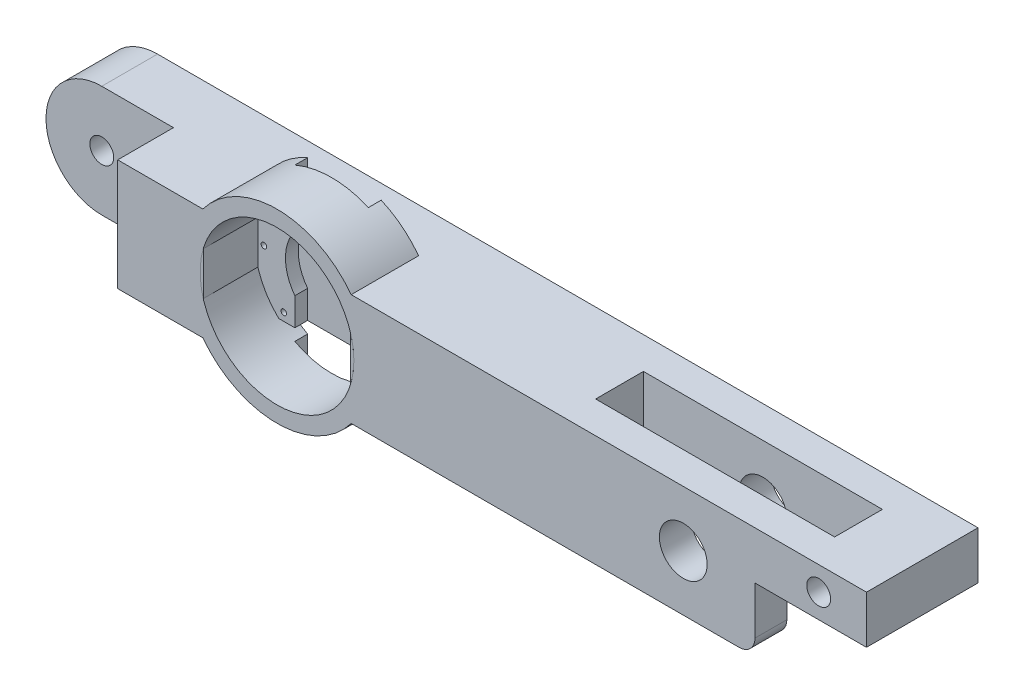
from build123d import *

# Parameters (mm, degrees)
SKETCH_2_W           = 400
SKETCH_2_H           = 70
SKETCH_2_W_2         = 70
SKETCH_2_H_2         = 30
EXTRUDE_2_DEPTH      = 70
SKETCH_3_R           = 7.5
SKETCH_3_R_2         = 15
CUT_EXTRUDE_1_DEPTH  = 282.113855937
SKETCH_4_W           = 120
SKETCH_4_H           = 30
SKETCH_4_W_2         = 30
CUT_EXTRUDE_2_DEPTH  = 120
FILLET_1_R           = 10
SKETCH_5_R           = 48.25
CUT_EXTRUDE_3_DEPTH  = 34.3
EXTRUDE_3_DEPTH      = 42.3
EXTRUDE_4_DEPTH      = 42.3
EXTRUDE_4_2_DEPTH    = 42.3
SKETCH_8_R           = 1.75
CUT_EXTRUDE_4_DEPTH  = 42.3
SKETCH_11_R          = 29
CUT_EXTRUDE_6_DEPTH  = 8
CUT_EXTRUDE_7_DEPTH  = 8
SKETCH_13_W          = 35
SKETCH_13_H          = 70
EXTRUDE_5_DEPTH      = 80
FILLET_2_R           = 35
SKETCH_14_R          = 7.5
CUT_EXTRUDE_8_DEPTH  = 295.436856558
SKETCH_15_W          = 46.18239298
SKETCH_15_H          = 8
CUT_EXTRUDE_10_DEPTH = 500


with BuildPart() as part:
    # 草图2 → 凸台-拉伸2 (new body)
    with BuildSketch(Plane.XY):
        Rectangle(SKETCH_2_W, SKETCH_2_H)
        with Locations((235, 20)):
            Rectangle(SKETCH_2_W_2, SKETCH_2_H_2)
    extrude(amount=EXTRUDE_2_DEPTH)

    # 草图3 → 切除-拉伸1 (cut, through all)
    with BuildSketch(Plane.XY.offset(70)):
        with Locations((240, 20)):
            Circle(SKETCH_3_R)
        with Locations((155, 0)):
            Circle(SKETCH_3_R_2)
    extrude(amount=-CUT_EXTRUDE_1_DEPTH, mode=Mode.SUBTRACT)

    # 草图4 → 切除-拉伸2 (cut)
    with BuildSketch(Plane.XZ.offset(35)):
        with Locations((140, 35)):
            Rectangle(SKETCH_4_W, SKETCH_4_H)
        with Locations((215, 35)):
            Rectangle(SKETCH_4_W_2, SKETCH_4_H)
    extrude(amount=-CUT_EXTRUDE_2_DEPTH, mode=Mode.SUBTRACT)

    # 圆角1
    fillet_1_edges = [part.edges().sort_by_distance(p)[0] for p in [
        (200, -35, 60),
        (200, -35, 10),
    ]]
    fillet(fillet_1_edges, radius=FILLET_1_R)

    # 草图5 → 切除-拉伸3 (cut)
    with BuildSketch(Plane.XY.offset(70)):
        with Locations((-100, 0)):
            Circle(SKETCH_5_R)
    extrude(amount=-CUT_EXTRUDE_3_DEPTH, mode=Mode.SUBTRACT)

    # 草图6 → 凸台-拉伸3 (add)
    with BuildSketch(Plane.XY.offset(70)):
        with BuildLine():
            ThreePointArc((-51.75, 0), (-55.668520983, -19.046849298), (-66.787615262, -35))
            Line((-66.787615262, -35), (-53.437541946, -35))
            ThreePointArc((-53.437541946, -35), (-44.749091946, -18.449923013), (-41.75, 0))
            ThreePointArc((-41.75, 0), (-44.749091946, 18.449923013), (-53.437541946, 35))
            Line((-53.437541946, 35), (-66.787615262, 35))
            ThreePointArc((-66.787615262, 35), (-55.668520983, 19.046849298), (-51.75, 0))
        make_face()
        with BuildLine():
            Line((-53.437541946, -35), (-66.787615262, -35))
            ThreePointArc((-66.787615262, -35), (-148.25, 0), (-66.787615262, 35))
            Line((-66.787615262, 35), (-53.437541946, 35))
            ThreePointArc((-53.437541946, 35), (-158.25, 0), (-53.437541946, -35))
        make_face()
        with BuildLine():
            ThreePointArc((-51.75, 0), (-55.668520983, -19.046849298), (-66.787615262, -35))
            Line((-66.787615262, -35), (-53.437541946, -35))
            ThreePointArc((-53.437541946, -35), (-44.749091946, -18.449923013), (-41.75, 0))
            ThreePointArc((-41.75, 0), (-44.749091946, 18.449923013), (-53.437541946, 35))
            Line((-53.437541946, 35), (-66.787615262, 35))
            ThreePointArc((-66.787615262, 35), (-55.668520983, 19.046849298), (-51.75, 0))
        make_face()
    extrude(amount=-EXTRUDE_3_DEPTH)

    # 草图8 → 切除-拉伸4 (cut)
    with BuildSketch(Plane.XY.offset(35.7)):
        with Locations((-142.5, 0)):
            Circle(SKETCH_8_R)
        with Locations((-130.0520382, 30.0520382)):
            Circle(SKETCH_8_R)
        with Locations((-100, 42.5)):
            Circle(SKETCH_8_R)
        with Locations((-69.9479618, 30.0520382)):
            Circle(SKETCH_8_R)
        with Locations((-57.5, 0)):
            Circle(SKETCH_8_R)
        with Locations((-69.9479618, -30.0520382)):
            Circle(SKETCH_8_R)
        with Locations((-100, -42.5)):
            Circle(SKETCH_8_R)
        with Locations((-130.0520382, -30.0520382)):
            Circle(SKETCH_8_R)
    extrude(amount=-CUT_EXTRUDE_4_DEPTH, mode=Mode.SUBTRACT)

    # 草图11 → 切除-拉伸6 (cut)
    with BuildSketch(Plane.XY.offset(35.7)):
        with Locations((-100, 0)):
            Circle(SKETCH_11_R)
    extrude(amount=-CUT_EXTRUDE_6_DEPTH, mode=Mode.SUBTRACT)

    # 草图12 → 切除-拉伸7 (cut)
    with BuildSketch(Plane.XY.offset(35.7)):
        with BuildLine():
            Line((-100, 29), (-100, 35))
            Line((-100, 35), (-123.09119649, 35))
            Line((-123.09119649, 35), (-123.09119649, 17.544134195))
            ThreePointArc((-123.09119649, 17.544134195), (-112.888368949, 25.978644034), (-100, 29))
        make_face()
        with BuildLine():
            Line((-76.90880351, 17.544134195), (-76.90880351, 35))
            Line((-76.90880351, 35), (-100, 35))
            Line((-100, 35), (-100, 29))
            ThreePointArc((-100, 29), (-87.111631051, 25.978644034), (-76.90880351, 17.544134195))
        make_face()
        with BuildLine():
            ThreePointArc((-100, -29), (-107.281043458, -28.071095564), (-114.09564598, -25.34389008))
            Line((-114.09564598, -25.34389008), (-114.09564598, -35))
            Line((-114.09564598, -35), (-100, -35))
            Line((-100, -35), (-100, -29))
        make_face()
        with BuildLine():
            Line((-85.90435402, -35), (-85.90435402, -25.34389008))
            ThreePointArc((-85.90435402, -25.34389008), (-92.718956542, -28.071095564), (-100, -29))
            Line((-100, -29), (-100, -35))
            Line((-100, -35), (-85.90435402, -35))
        make_face()
    extrude(amount=-CUT_EXTRUDE_7_DEPTH, mode=Mode.SUBTRACT)

    # 草图13 → 凸台-拉伸5 (add)
    with BuildSketch(Plane.ZY.offset(200)):
        with Locations((17.5, 0)):
            Rectangle(SKETCH_13_W, SKETCH_13_H)
    extrude(amount=EXTRUDE_5_DEPTH)

    # 圆角2
    fillet_2_edges = [part.edges().sort_by_distance(p)[0] for p in [
        (-280, 35, 17.5),
        (-280, -35, 17.5),
    ]]
    fillet(fillet_2_edges, radius=FILLET_2_R - 0.0001)  # a hair under: the kernel refuses the full size

    # 草图14 → 切除-拉伸8 (cut, through all)
    with BuildSketch(Plane.XY.offset(70)):
        with Locations((-245, 0)):
            Circle(SKETCH_14_R)
    extrude(amount=-CUT_EXTRUDE_8_DEPTH, mode=Mode.SUBTRACT)

    # 草图15 → 切除-拉伸10 (cut, symmetric)
    with BuildSketch(Plane(origin=(0, 35, 0), x_dir=(1, 0, 0), z_dir=(0, 1, 0))):
        with Locations((-100, -31.7)):
            Rectangle(SKETCH_15_W, SKETCH_15_H)
    extrude(amount=CUT_EXTRUDE_10_DEPTH, both=True, mode=Mode.SUBTRACT)


with BuildPart() as body_2:
    # 草图7 → 凸台-拉伸4 (new body)
    with BuildSketch(Plane.XY.offset(70)):
        with BuildLine():
            Line((-146.25, -13.747727085), (-146.25, 13.747727085))
            ThreePointArc((-146.25, 13.747727085), (-148.25, 0), (-146.25, -13.747727085))
        make_face()
    extrude(amount=-EXTRUDE_4_DEPTH)


with BuildPart() as body_3:
    # 草图7 → Extrude 4 2 (new body)
    with BuildSketch(Plane.XY.offset(70)):
        with BuildLine():
            ThreePointArc((-51.75, 0), (-52.252617873, 6.946221995), (-53.75, 13.747727085))
            Line((-53.75, 13.747727085), (-53.75, -13.747727085))
            ThreePointArc((-53.75, -13.747727085), (-52.252617873, -6.946221995), (-51.75, 0))
        make_face()
    extrude(amount=-EXTRUDE_4_2_DEPTH)


solid = Compound([part.part, body_2.part, body_3.part])
